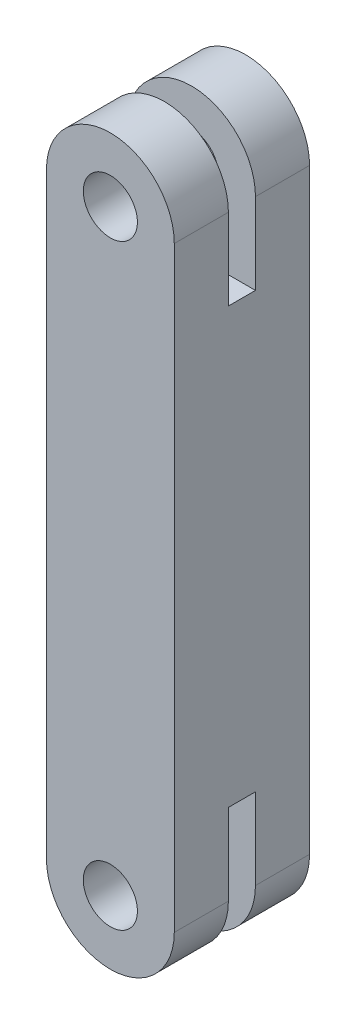
from build123d import *

# Parameters (mm, degrees)
SKETCH1_R           = 3.175
BOSS_EXTRUDE1_DEPTH = 7.9375
SKETCH2_W           = 15
SKETCH2_H           = 17.025
CUT_EXTRUDE1_DEPTH  = 1.5875


with BuildPart() as part:
    # Sketch1 → Boss-Extrude1 (new, symmetric)
    with BuildSketch(Plane.XY):
        with BuildLine():
            Line((-7.5, 70), (-7.5, 0))
            ThreePointArc((-7.5, 0), (0, -7.5), (7.5, 0))
            Line((7.5, 0), (7.5, 70))
            ThreePointArc((7.5, 70), (0, 77.5), (-7.5, 70))
        make_face()
        with Locations((0, 70)):
            Circle(SKETCH1_R, mode=Mode.SUBTRACT)
        Circle(SKETCH1_R, mode=Mode.SUBTRACT)
    extrude(amount=BOSS_EXTRUDE1_DEPTH, both=True)

    # Sketch2 → Cut-Extrude1 (cut, symmetric)
    with BuildSketch(Plane.XY):
        with Locations((0, 1.0125)):
            Rectangle(SKETCH2_W, SKETCH2_H)
        with Locations((0, 68.9875)):
            Rectangle(SKETCH2_W, SKETCH2_H)
    extrude(amount=CUT_EXTRUDE1_DEPTH, both=True, mode=Mode.SUBTRACT)


solid = part.part
